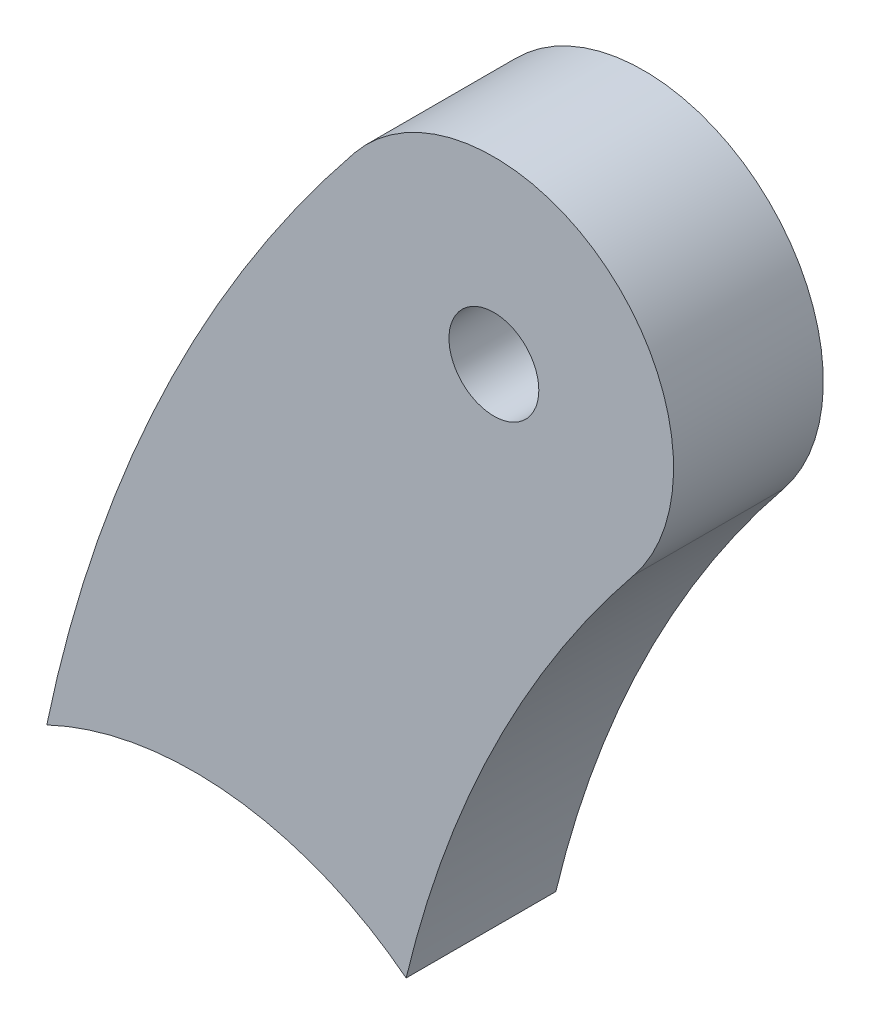
from build123d import *

# Parameters (mm, degrees)
ESQUISSE1_R        = 1.5
BOSS_EXTRU_1_DEPTH = 5


with BuildPart() as part:
    # Esquisse1 → Boss.-Extru.1 (new body)
    with BuildSketch(Plane.XY):
        with BuildLine():
            ThreePointArc((-39.666666667, 32.055507414), (-46.089810322, 21.834133472), (-49.930555556, 10.389399497))
            ThreePointArc((-49.930555556, 10.389399497), (-43.743567635, 11.431158196), (-37.930555556, 9.070444049))
            ThreePointArc((-37.930555556, 9.070444049), (-34.994400066, 17.216037988), (-30.333333333, 24.513035081))
            ThreePointArc((-30.333333333, 24.513035081), (-31.228763834, 32.950937914), (-39.666666667, 32.055507414))
        make_face()
        with Locations((-35, 28.284271247)):
            Circle(ESQUISSE1_R, mode=Mode.SUBTRACT)
    extrude(amount=BOSS_EXTRU_1_DEPTH)


solid = part.part
